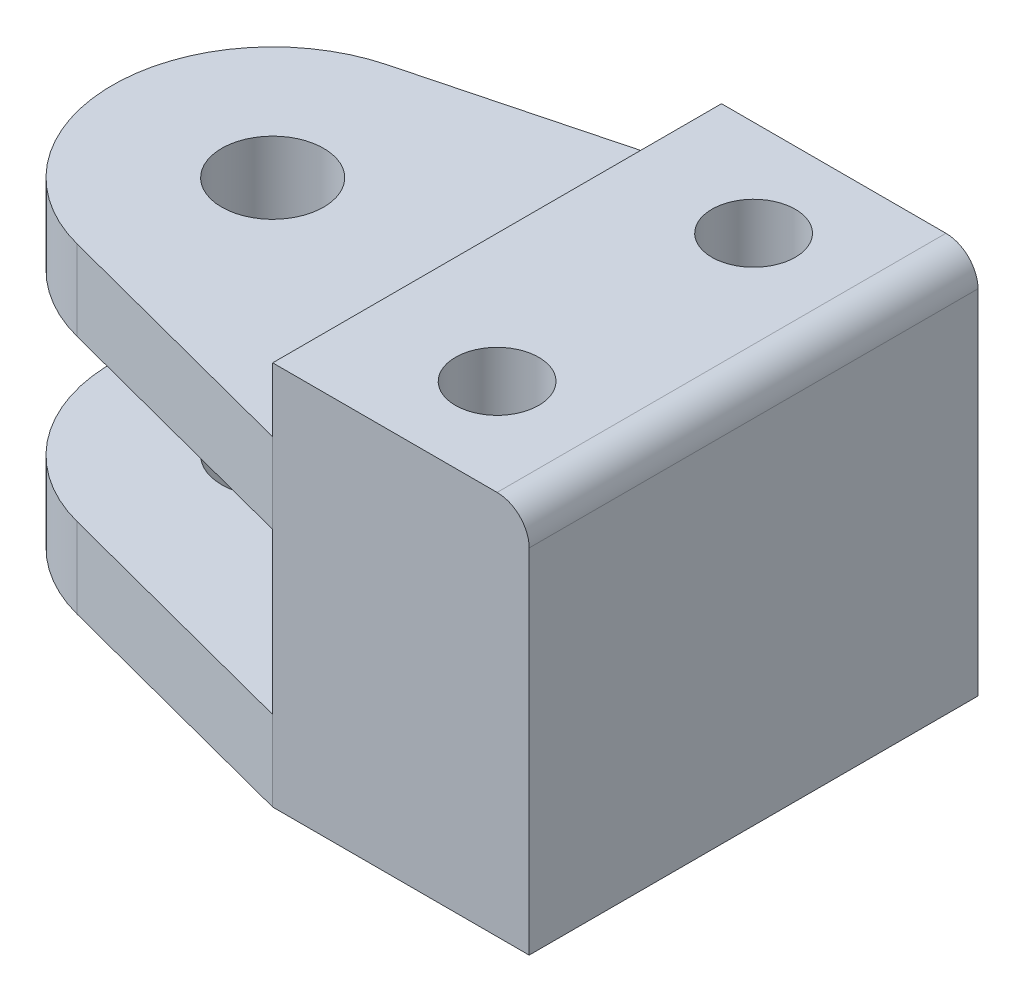
from build123d import *

# Parameters (mm, degrees)
BOSS_EXTRUDE1_DEPTH      = 7
BOSS_EXTRUDE1_DEPTH_BACK = 5
SKETCH1_W                = 8
SKETCH1_H                = 14
BOSS_EXTRUDE2_START      = 2.5
SKETCH1_3_R              = 1.59
BOSS_EXTRUDE2_DEPTH      = 2.5
BOSS_EXTRUDE3_START      = -5
SKETCH1_4_R              = 1.59
BOSS_EXTRUDE3_DEPTH      = 2.5
M2_CLEARANCE_HOLE1_D     = 2.6
CUT_EXTRUDE1_DEPTH       = 3
FILLET2_R                = 1


with BuildPart() as part:
    # Sketch1 → Boss-Extrude1 (new, two sides: drawn at the far end of the back side and taken through both)
    with BuildSketch(Plane(origin=(0, 0, 0), x_dir=(1, 0, 0), z_dir=(0, 1, 0)).offset(-BOSS_EXTRUDE1_DEPTH_BACK)):
        with Locations((11, 0)):
            Rectangle(SKETCH1_W, SKETCH1_H)
    extrude(amount=BOSS_EXTRUDE1_DEPTH + BOSS_EXTRUDE1_DEPTH_BACK)

    # Sketch1<3> → Boss-Extrude2 (add)
    with BuildSketch(Plane(origin=(0, 0, 0), x_dir=(1, 0, 0), z_dir=(0, 1, 0)).offset(BOSS_EXTRUDE2_START)):
        with BuildLine():
            Line((7, -7), (7, 7))
            Line((7, 7), (-1.265715623, 4.837144195))
            ThreePointArc((-1.265715623, 4.837144195), (-5, 0), (-1.265715623, -4.837144195))
            Line((-1.265715623, -4.837144195), (7, -7))
        make_face()
        Circle(SKETCH1_3_R, mode=Mode.SUBTRACT)
    extrude(amount=BOSS_EXTRUDE2_DEPTH)

    # Sketch1<4> → Boss-Extrude3 (add)
    with BuildSketch(Plane(origin=(0, 0, 0), x_dir=(1, 0, 0), z_dir=(0, 1, 0)).offset(BOSS_EXTRUDE3_START)):
        with BuildLine():
            Line((7, -7), (7, 7))
            Line((7, 7), (-1.265715623, 4.837144195))
            ThreePointArc((-1.265715623, 4.837144195), (-5, 0), (-1.265715623, -4.837144195))
            Line((-1.265715623, -4.837144195), (7, -7))
        make_face()
        Circle(SKETCH1_4_R, mode=Mode.SUBTRACT)
    extrude(amount=BOSS_EXTRUDE3_DEPTH)

    # M2 Clearance Hole1 (through all)
    with Locations(Plane(origin=(0, 7, 0), x_dir=(1, 0, 0), z_dir=(0, 1, 0))):
        with Locations((11, 4), (11, -4)):
            Hole(M2_CLEARANCE_HOLE1_D / 2)

    # Sketch4 → Cut-Extrude1 (cut)
    with BuildSketch(Plane.XZ.offset(5)):
        Polygon((9.816431948, 1.95), (12.183568052, 1.95), (13.367136104, 4), (12.183568052, 6.05), (9.816431948, 6.05), (8.632863896, 4), align=None)
        Polygon((8.632863896, -4), (9.816431948, -6.05), (12.183568052, -6.05), (13.367136104, -4), (12.183568052, -1.95), (9.816431948, -1.95), align=None)
    extrude(amount=-CUT_EXTRUDE1_DEPTH, mode=Mode.SUBTRACT)

    # Fillet2
    fillet2_edges = [part.edges().sort_by_distance(p)[0] for p in [
        (15, 7, 0),
    ]]
    fillet(fillet2_edges, radius=FILLET2_R)


solid = part.part
